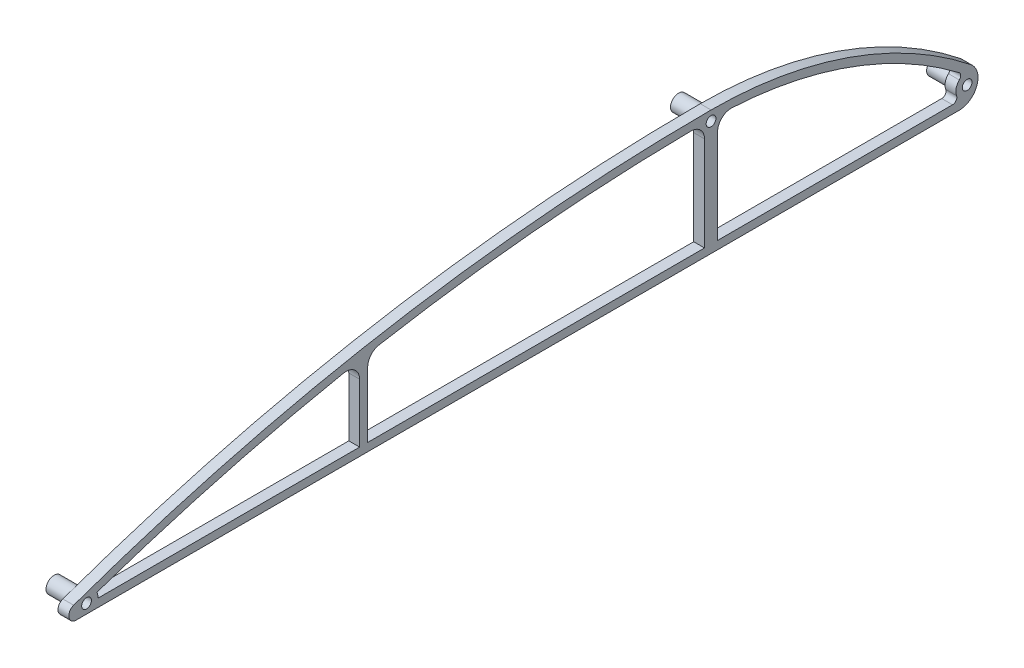
from build123d import *
from build123d.topology import SkipClean

# Parameters (mm, degrees)
BOSS_EXTRU_1_DEPTH      = 2
ESQUISSE4_R             = 0.9
ENL_V_MAT_EXTRU_2_DEPTH = 176.894862906
ENL_V_MAT_EXTRU_3_DEPTH = 4
CONG_2_R                = 1.35
CONG_3_R                = 2.5
CONG_4_R                = 0.8
BOSS_EXTRU_2_DEPTH      = 6


with BuildPart() as part:
    # Esquisse2 → Boss.-Extru.1 (new body)
    with BuildSketch(Plane(origin=(0, 0, 0), x_dir=(0, 0, -1), z_dir=(1, 0, 0))):
        with BuildLine():
            Line((0, 0), (170.873171093, 0))
            ThreePointArc((170.873171093, 0), (174.177922559, 2.347343181), (173.049882129, 6.240789861))
            ThreePointArc((173.049882129, 6.240789861), (150.444362328, 18.689979585), (125, 23))
            ThreePointArc((125, 23), (61.450806457, 17.202138822), (0, 0))
        make_face()
    extrude(amount=BOSS_EXTRU_1_DEPTH)

    # Esquisse4 → Enlèv. mat.-Extru.2 (cut, through all)
    with BuildSketch(Plane(origin=(2, 0, 0), x_dir=(0, 0, -1), z_dir=(1, 0, 0))):
        with Locations((125, 21.2)):
            Circle(ESQUISSE4_R)
        with Locations((172.368958832, 3.328337296)):
            Circle(ESQUISSE4_R)
        with Locations((9.5, 1.731368161)):
            Circle(ESQUISSE4_R)
    extrude(amount=-ENL_V_MAT_EXTRU_2_DEPTH, mode=Mode.SUBTRACT)

    # Esquisse9 → Enlèv. mat.-Extru.3 (cut)
    with BuildSketch(Plane(origin=(0, 0, 0), x_dir=(0, 0, -1), z_dir=(1, 0, 0))):
        with BuildLine():
            Line((126.213985158, 1.5), (171.335913464, 1.5))
            ThreePointArc((171.335913464, 1.5), (170.282716542, 3.568322942), (171.778038927, 5.343483362))
            ThreePointArc((171.778038927, 5.343483362), (150.318961844, 17.152112342), (126.213985158, 21.497892659))
            Line((126.213985158, 21.497892659), (126.213985158, 1.5))
        make_face()
        with BuildLine():
            Line((11.587215555, 1.5), (60, 1.5))
            Line((60, 1.5), (60, 15.405547145))
            ThreePointArc((60, 15.405547145), (35.486713367, 9.848596531), (11.435943567, 2.545077264))
            ThreePointArc((11.435943567, 2.545077264), (11.578340432, 2.03220208), (11.587215555, 1.5))
        make_face()
        with BuildLine():
            Line((61.5, 1.5), (123.786014842, 1.5))
            Line((123.786014842, 1.5), (123.786014842, 21.497892659))
            ThreePointArc((123.786014842, 21.497892659), (92.512776663, 19.987580782), (61.5, 15.685935533))
            Line((61.5, 15.685935533), (61.5, 1.5))
        make_face()
    extrude(amount=ENL_V_MAT_EXTRU_3_DEPTH, mode=Mode.SUBTRACT)

    # Congé2
    cong_2_edges = [part.edges().sort_by_distance(p)[0] for p in [
        (1, 0, 0),
    ]]
    fillet(cong_2_edges, radius=CONG_2_R)

    # Congé3
    cong_3_edges = [part.edges().sort_by_distance(p)[0] for p in [
        (1, 21.497892659, -126.213985158),
        (1, 21.497892659, -123.786014842),
        (1, 15.405547145, -60),
        (1, 15.685935533, -61.5),
    ]]
    fillet(cong_3_edges, radius=CONG_3_R)

    # Congé4
    cong_4_edges = [part.edges().sort_by_distance(p)[0] for p in [
        (1, 1.5, -171.335913464),
        (1, 5.343483362, -171.778038927),
    ]]
    fillet(cong_4_edges, radius=CONG_4_R)

    # Esquisse12 → Boss.-Extru.2 (add)
    with SkipClean():  # the faces are left unmerged after this step: merging them gives an invalid solid
        with BuildSketch(Plane(origin=(2, 0, 0), x_dir=(0, 0, -1), z_dir=(1, 0, 0))):
            with BuildLine():
                Line((124.363645394, 19.841672788), (124.618187236, 20.385003673))
                ThreePointArc((124.618187236, 20.385003673), (125.00160755, 22.099998564), (125.378898894, 20.383644913))
                Line((125.378898894, 20.383644913), (125.631498157, 19.839408188))
                ThreePointArc((125.631498157, 19.839408188), (125.002679249, 22.699997607), (124.363645394, 19.841672788))
            make_face()
            with BuildLine():
                Line((8.866072607, 0.37190648), (9.119643564, 0.915691153))
                ThreePointArc((9.119643564, 0.915691153), (9.5, 2.631368161), (9.880356436, 0.915691153))
                Line((9.880356436, 0.915691153), (10.133927393, 0.37190648))
                ThreePointArc((10.133927393, 0.37190648), (9.5, 3.231368161), (8.866072607, 0.37190648))
            make_face()
            with BuildLine():
                Line((171.735031439, 1.968875616), (171.988602396, 2.512660288))
                ThreePointArc((171.988602396, 2.512660288), (172.368958832, 4.228337296), (172.749315267, 2.512660288))
                Line((172.749315267, 2.512660288), (173.002886224, 1.968875616))
                ThreePointArc((173.002886224, 1.968875616), (172.368958832, 4.828337296), (171.735031439, 1.968875616))
            make_face()
        extrude(amount=-BOSS_EXTRU_2_DEPTH)


solid = part.part
